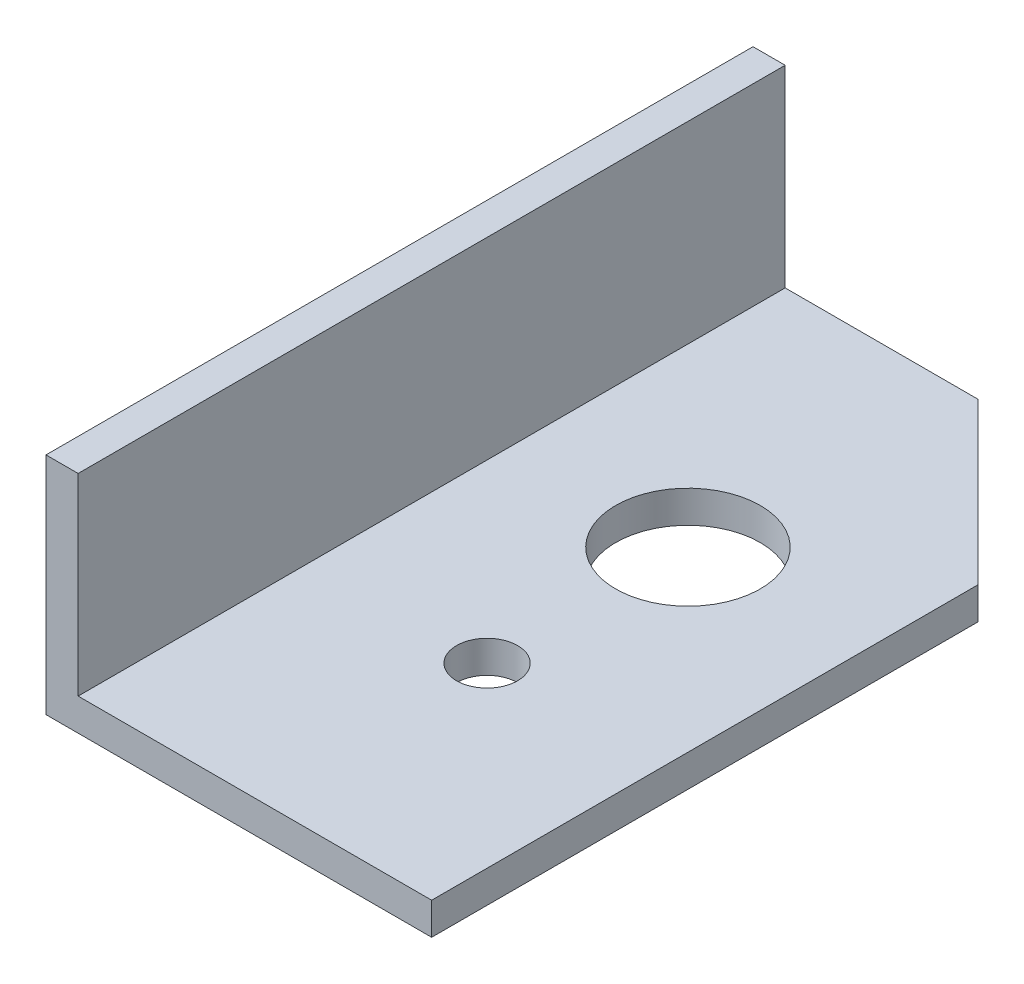
from build123d import *

# Parameters (mm, degrees)
EXTRUDE_1_DEPTH     = 44
CHAMFER_1_SIZE      = 10
SKETCH_4_R          = 4.5
SKETCH_4_R_2        = 1.9
CUT_EXTRUDE_1_DEPTH = 52.536394907


with BuildPart() as part:
    # Эскиз2 → Вытянуть-Тонкостенный1 (new body)
    with BuildSketch(Plane.XY):
        Polygon((24, 0), (0, 0), (0, 14), (2, 14), (2, 2), (24, 2), align=None)
    extrude(amount=EXTRUDE_1_DEPTH)

    # Фаска1
    chamfer_1_edges = [part.edges().sort_by_distance(p)[0] for p in [
        (24, 1, 0),
    ]]
    chamfer(chamfer_1_edges, length=CHAMFER_1_SIZE)

    # Эскиз4 → Вырез-Вытянуть1 (cut, through all)
    with BuildSketch(Plane(origin=(0, 2, 0), x_dir=(-1, 0, 0), z_dir=(0, 1, 0))):
        with Locations((-12.95, 17)):
            Circle(SKETCH_4_R)
        with Locations((-12.95, 29.5)):
            Circle(SKETCH_4_R_2)
    extrude(amount=-CUT_EXTRUDE_1_DEPTH, mode=Mode.SUBTRACT)


solid = part.part
